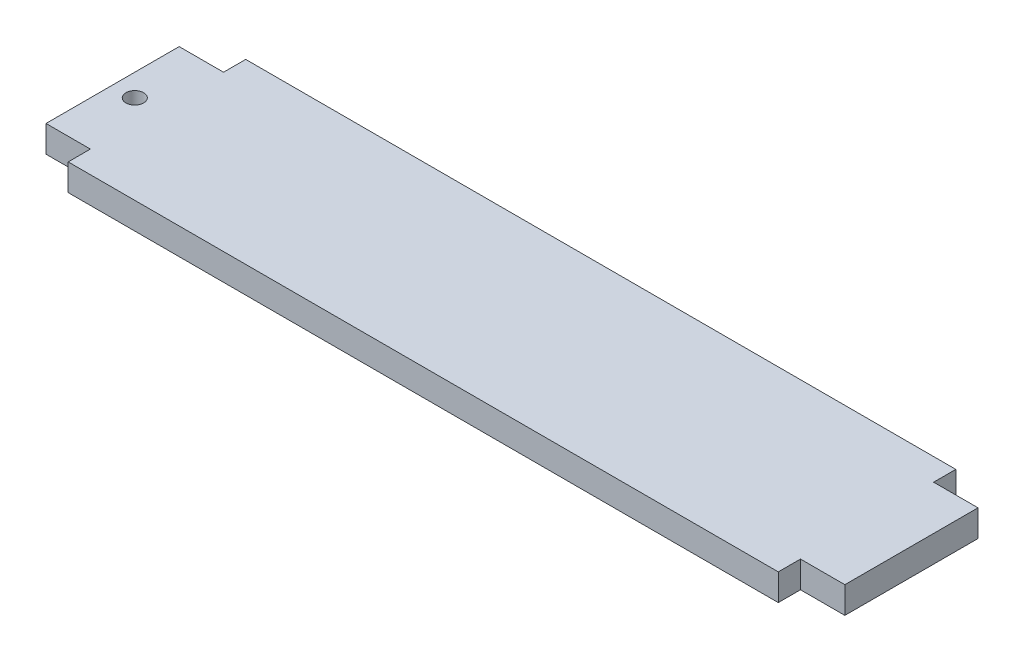
from build123d import *

# Parameters (mm, degrees)
SKETCH1_W                 = 20
SKETCH1_H                 = 3
BOSS_EXTRUDE1_DEPTH       = 90
SKETCH2_W                 = 5
SKETCH2_H                 = 2.5
CUT_EXTRUDE1_DEPTH        = 90
SKETCH6_W                 = 5
SKETCH6_H                 = 2.5
CUT_EXTRUDE2_DEPTH        = 90
F_2_0MM_DOWEL_HOLE1_D     = 2
F_2_0MM_DOWEL_HOLE1_DEPTH = 12.75
F_2_0MM_DOWEL_HOLE1_TIP   = 0.600860619


with BuildPart() as part:
    # Sketch1 → Boss-Extrude1 (new body)
    with BuildSketch(Plane(origin=(0, 0, 0), x_dir=(0, 0, -1), z_dir=(1, 0, 0))):
        with Locations((-0.136889684, 4.101965352)):
            Rectangle(SKETCH1_W, SKETCH1_H)
    extrude(amount=BOSS_EXTRUDE1_DEPTH)

    # Sketch2 → Cut-Extrude1 (cut)
    with BuildSketch(Plane.XZ.offset(-2.601965352)):
        with Locations((2.5, -8.613110316)):
            Rectangle(SKETCH2_W, SKETCH2_H)
    cut_extrude1 = extrude(amount=-CUT_EXTRUDE1_DEPTH, mode=Mode.SUBTRACT)

    # Sketch6 → Cut-Extrude2 (cut)
    with BuildSketch(Plane(origin=(0, 5.601965352, 0), x_dir=(1, 0, 0), z_dir=(0, 1, 0))):
        with Locations((2.5, -8.886889684)):
            Rectangle(SKETCH6_W, SKETCH6_H)
    cut_extrude2 = extrude(amount=-CUT_EXTRUDE2_DEPTH, mode=Mode.SUBTRACT)

    # Mirror2: Cut-Extrude1, Cut-Extrude2 across plane
    add(cut_extrude1.mirror(Plane(origin=(45, 0, 0), x_dir=(0, 0, 1), z_dir=(1, 0, 0))), mode=Mode.SUBTRACT)
    add(cut_extrude2.mirror(Plane(origin=(45, 0, 0), x_dir=(0, 0, 1), z_dir=(1, 0, 0))), mode=Mode.SUBTRACT)

    # Ø2.0mm Dowel Hole1
    with Locations(Plane(origin=(2.5, 2.601965352, 0.136889684), x_dir=(0, 0, -1), z_dir=(0, -1, 0))):
        with Locations((0, 0)):
            Hole(F_2_0MM_DOWEL_HOLE1_D / 2, depth=F_2_0MM_DOWEL_HOLE1_DEPTH)
            with Locations((0, 0, -(F_2_0MM_DOWEL_HOLE1_DEPTH + F_2_0MM_DOWEL_HOLE1_TIP / 2))):  # 118° drill point
                Cone(0, F_2_0MM_DOWEL_HOLE1_D / 2, F_2_0MM_DOWEL_HOLE1_TIP, mode=Mode.SUBTRACT)


solid = part.part
